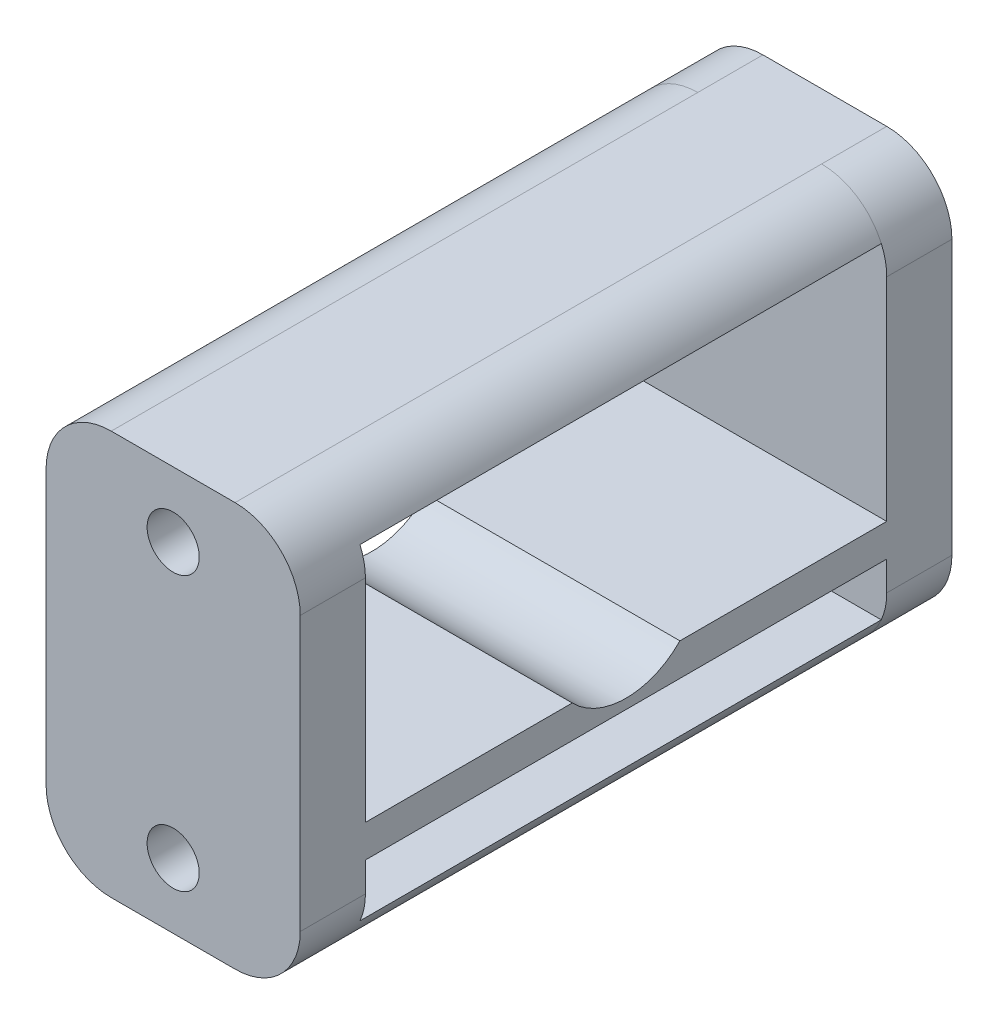
from build123d import *

# Parameters (mm, degrees)
ESQUISSE1_W             = 39
ESQUISSE1_H             = 62
BOSS_EXTRU_1_DEPTH      = 10
ESQUISSE2_R             = 4
ENL_V_MAT_EXTRU_1_DEPTH = 10
CONG_1_R                = 10
BOSS_EXTRU_2_DEPTH      = 80
CONG_2_R                = 10
ESQUISSE4_W             = 39
ESQUISSE4_H             = 62
BOSS_EXTRU_3_DEPTH      = 10
CONG_3_START            = 10
CONG_3_DEPTH            = 91
ENL_V_START             = -100
ESQUISSE5_R             = 4
ENL_V_MAT_EXTRU_2_DEPTH = 100
ESQUISSE6_W             = 39
ESQUISSE6_H             = 5
BOSS_EXTRU_4_DEPTH      = 80
ESQUISSE7_R             = 11.5
ENL_V_MAT_EXTRU_3_DEPTH = 112.722871427


with BuildPart() as part:
    # Esquisse1 → Boss.-Extru.1 (new body)
    with BuildSketch(Plane.XY):
        Rectangle(ESQUISSE1_W, ESQUISSE1_H)
    extrude(amount=BOSS_EXTRU_1_DEPTH)

    # Esquisse2 → Enlèv. mat.-Extru.1 (cut)
    with BuildSketch(Plane.XY.offset(10)):
        with Locations((0, 21)):
            Circle(ESQUISSE2_R)
        with Locations((0, -21)):
            Circle(ESQUISSE2_R)
    extrude(amount=-ENL_V_MAT_EXTRU_1_DEPTH, mode=Mode.SUBTRACT)

    # Congé1
    cong_1_edges = [part.edges().sort_by_distance(p)[0] for p in [
        (-19.5, 31, 5),
        (-19.5, -31, 5),
        (19.5, -31, 5),
        (19.5, 31, 5),
    ]]
    fillet(cong_1_edges, radius=CONG_1_R)

    # Esquisse3 → Boss.-Extru.2 (add)
    with BuildSketch(Plane.XY.offset(10)):
        Polygon((0, 25), (19.5, 25), (19.5, 31), (-19.5, 31), (-19.5, 25), align=None)
        Polygon((0, -25), (19.5, -25), (19.5, -31), (-19.5, -31), (-19.5, -25), align=None)
    extrude(amount=BOSS_EXTRU_2_DEPTH)

    # Congé2
    # the kernel refuses this fillet: 10 mm, written as the material it takes off along each edge
    with BuildSketch(Plane(origin=(-19.5, 31, -12.912878475), x_dir=(1, 0, 0), z_dir=(0, 0, 1)), Plane(origin=(19.5, -31, -12.912878475), x_dir=(-1, 0, 0), z_dir=(0, 0, 1))) as cong_2_piece_1:
        with BuildLine():
            CenterArc((9.16515139, -10), CONG_2_R, 90, 66.421821522)
            Line((0, -6), (-0.183303028, -5.92))
            ThreePointArc((-0.183303028, -5.92), (-0.2, -3), (-0.2, 0))
            Line((-0.2, 0), (0, 0.2))
            Line((0, 0.2), (9.16515139, 0.2))
            Line((9.16515139, 0.2), (9.16515139, 0))
        make_face()
    extrude(amount=125.82575695, mode=Mode.SUBTRACT)
    with BuildSketch(Plane(origin=(19.5, 31, -12.912878475), x_dir=(-1, 0, 0), z_dir=(0, 0, 1)), Plane(origin=(-19.5, -31, -12.912878475), x_dir=(1, 0, 0), z_dir=(0, 0, 1))) as cong_2_piece_2:
        with BuildLine():
            CenterArc((9.16515139, 10), CONG_2_R, 203.578178478, 66.421821522)
            Line((0, 6), (-0.183303028, 5.92))
            ThreePointArc((-0.183303028, 5.92), (-0.2, 3), (-0.2, 0))
            Line((-0.2, 0), (0, -0.2))
            Line((0, -0.2), (9.16515139, -0.2))
            Line((9.16515139, -0.2), (9.16515139, 0))
        make_face()
    extrude(amount=125.82575695, mode=Mode.SUBTRACT)

    # Esquisse4 → Boss.-Extru.3 (add)
    with BuildSketch(Plane.XY.offset(90)):
        Rectangle(ESQUISSE4_W, ESQUISSE4_H)
    extrude(amount=BOSS_EXTRU_3_DEPTH)

    # Congé3: read off the stored shape, not the designer's step
    # Congé3 outline → Congé3 (cut)
    with BuildSketch(Plane.XY.offset(CONG_3_START)):
        with BuildLine():
            ThreePointArc((-9.5, -31), (-16.571067812, -28.071067812), (-19.5, -21))
            Line((-19.5, -21), (-19.5, -31))
            Line((-19.5, -31), (-9.5, -31))
        make_face()
        with BuildLine():
            ThreePointArc((19.5, -21), (16.571067812, -28.071067812), (9.5, -31))
            Line((9.5, -31), (19.5, -31))
            Line((19.5, -31), (19.5, -21))
        make_face()
        with BuildLine():
            ThreePointArc((-19.5, 21), (-16.571067812, 28.071067812), (-9.5, 31))
            Line((-9.5, 31), (-19.5, 31))
            Line((-19.5, 31), (-19.5, 21))
        make_face()
        with BuildLine():
            ThreePointArc((9.5, 31), (16.571067812, 28.071067812), (19.5, 21))
            Line((19.5, 21), (19.5, 31))
            Line((19.5, 31), (9.5, 31))
        make_face()
    extrude(amount=CONG_3_DEPTH, mode=Mode.SUBTRACT)

    # Esquisse5 → Enlèv. mat.-Extru.2 (cut)
    with BuildSketch(Plane(origin=(0, 0, 90), x_dir=(-1, 0, 0), z_dir=(0, 0, -1)).offset(ENL_V_START)):
        with Locations(Location((0, 21, 0), (0, 0, 180))):
            Circle(ESQUISSE5_R)
        with Locations(Location((0, -21, 0), (0, 0, 180))):
            Circle(ESQUISSE5_R)
    extrude(amount=ENL_V_MAT_EXTRU_2_DEPTH, mode=Mode.SUBTRACT)

    # Esquisse6 → Boss.-Extru.4 (add)
    with BuildSketch(Plane(origin=(0, 0, 90), x_dir=(-1, 0, 0), z_dir=(0, 0, -1))):
        with Locations((0, -14)):
            Rectangle(ESQUISSE6_W, ESQUISSE6_H)
    extrude(amount=BOSS_EXTRU_4_DEPTH)

    # Esquisse7 → Enlèv. mat.-Extru.3 (cut, through all)
    with BuildSketch(Plane.ZY.offset(19.5)):
        with Locations((50, -3.5)):
            Circle(ESQUISSE7_R)
    extrude(amount=-ENL_V_MAT_EXTRU_3_DEPTH, mode=Mode.SUBTRACT)


solid = part.part
